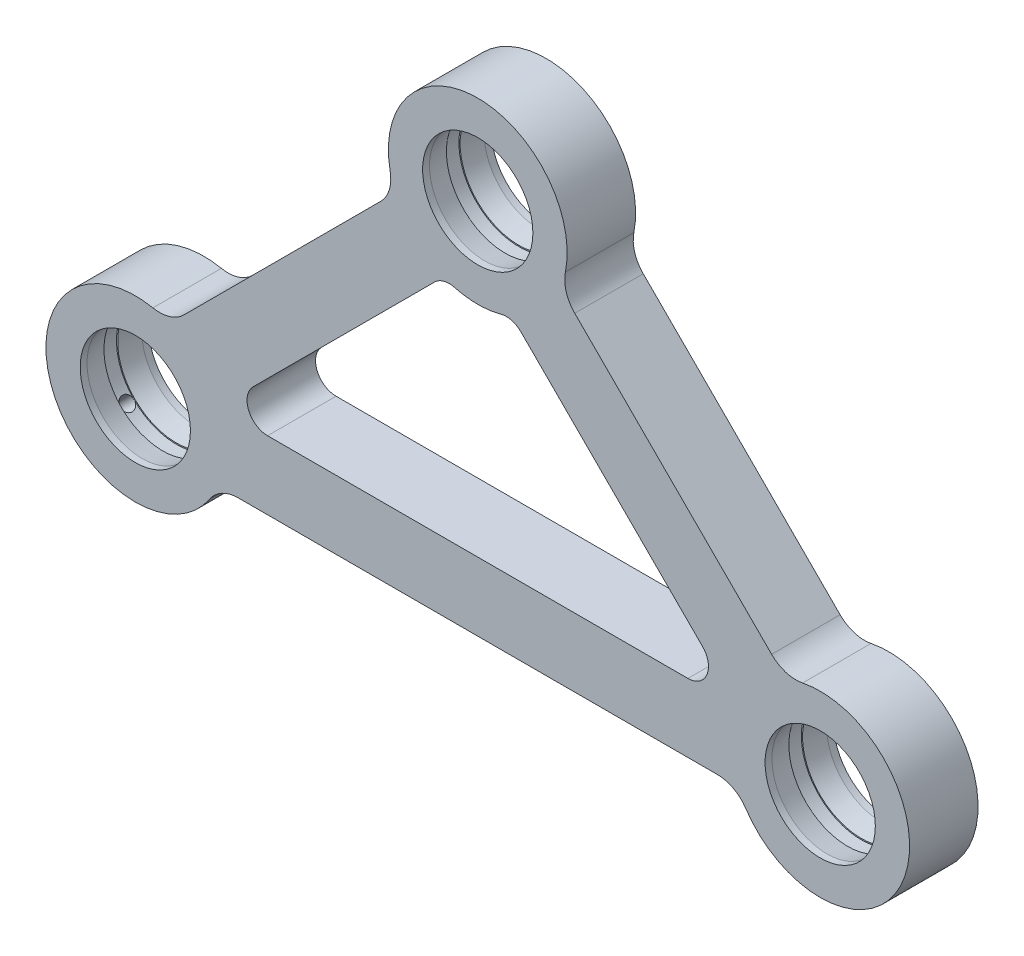
from build123d import *

# Parameters (mm, degrees)
SKETCH1_R               = 8.05
BOSS_EXTRUDE1_DEPTH     = 8
CUT_EXTRUDE1_DEPTH      = 1
CUT_EXTRUDE1_DEPTH_BACK = 1
SKETCH3_R               = 8.755307923
SKETCH4_R               = 1
CUT_EXTRUDE2_DEPTH      = 6
FILLET1_R               = 3
FILLET2_R               = 5
SKETCH5_R               = 1
CUT_EXTRUDE3_DEPTH      = 10
DRAFT4_ANGLE            = -10
DRAFT6_ANGLE            = -10
SKETCH6_R               = 1
CUT_EXTRUDE4_DEPTH      = 10
BOSS_EXTRUDE3_START     = 1
SKETCH7_R               = 8.05
BOSS_EXTRUDE3_DEPTH     = 1
SKETCH11_R              = 8.05
BOSS_EXTRUDE4_DEPTH     = 1


with BuildPart() as part:
    # Sketch1 → Boss-Extrude1 (new body)
    with BuildSketch(Plane.XY):
        with BuildLine():
            Line((11.402892275, 45.011963645), (-21.549967203, 12.059104167))
            ThreePointArc((-21.549967203, 12.059104167), (-38.594631457, -4.994018792), (-14.483854895, -5))
            Line((-14.483854895, -5), (61.407847779, -5))
            ThreePointArc((61.407847779, -5), (85.518624341, -4.994018792), (68.473960087, 12.059104167))
            Line((68.473960087, 12.059104167), (35.521100609, 45.011963645))
            ThreePointArc((35.521100609, 45.011963645), (23.461996442, 63.05), (11.402892275, 45.011963645))
        make_face()
        with BuildLine():
            Line((-14.466935746, 5), (18.473960087, 37.940895833))
            ThreePointArc((18.473960087, 37.940895833), (23.461996442, 36.95), (28.450032797, 37.940895833))
            Line((28.450032797, 37.940895833), (61.39092863, 5))
            Line((61.39092863, 5), (-14.466935746, 5))
        make_face(mode=Mode.SUBTRACT)
        with Locations((-26.538003558, 0)):
            Circle(SKETCH1_R, mode=Mode.SUBTRACT)
        with Locations((23.461996442, 50)):
            Circle(SKETCH1_R, mode=Mode.SUBTRACT)
        with Locations((73.461996442, 0)):
            Circle(SKETCH1_R, mode=Mode.SUBTRACT)
    extrude(amount=BOSS_EXTRUDE1_DEPTH)

    # Sketch3 → Cut-Extrude1 (cut, two sides: drawn at the far end of the back side and taken through both)
    with BuildSketch(Plane.XY.offset(4).offset(-CUT_EXTRUDE1_DEPTH_BACK)):
        with Locations((-26.538003558, 0)):
            Circle(SKETCH3_R)
        with Locations((23.461996442, 50)):
            Circle(SKETCH3_R)
        with Locations((73.461996442, 0)):
            Circle(SKETCH3_R)
    extrude(amount=CUT_EXTRUDE1_DEPTH + CUT_EXTRUDE1_DEPTH_BACK, mode=Mode.SUBTRACT)

    # Sketch4 → Cut-Extrude2 (cut)
    with BuildSketch(Plane(origin=(0, 62.95, 0), x_dir=(-1, 0, 0), z_dir=(0, -1, 0))):
        with Locations((-23.461996442, -4)):
            Circle(SKETCH4_R)
    extrude(amount=CUT_EXTRUDE2_DEPTH, mode=Mode.SUBTRACT)

    # Fillet1
    fillet1_edges = [part.edges().sort_by_distance(p)[0] for p in [
        (-14.466935746, 5, 4),
        (18.473960087, 37.940895833, 4),
        (28.450032797, 37.940895833, 4),
        (61.39092863, 5, 4),
    ]]
    fillet(fillet1_edges, radius=FILLET1_R)

    # Fillet2
    fillet2_edges = [part.edges().sort_by_distance(p)[0] for p in [
        (68.473960087, 12.059104167, 4),
        (35.521100609, 45.011963645, 4),
        (11.402892275, 45.011963645, 4),
        (-21.549967203, 12.059104167, 4),
        (-14.483854895, -5, 4),
        (61.407847779, -5, 4),
    ]]
    fillet(fillet2_edges, radius=FILLET2_R)

    # Sketch5 → Cut-Extrude3 (cut)
    with BuildSketch(Plane(origin=(45.888031037, -45.888031037, 0), x_dir=(0, 0, 1), z_dir=(-0.7071067811865489, 0.7071067811865462, 0))):
        with Locations((4, 51.945475844)):
            Circle(SKETCH5_R)
    extrude(amount=CUT_EXTRUDE3_DEPTH, mode=Mode.SUBTRACT)

    # Draft4
    draft4_faces = [part.faces().sort_by_distance(p)[0] for p in [
        (-34.588003558, 0, 6.5),
        (15.411996442, 50, 6.5),
        (65.411996442, 0, 6.5),
    ]]
    draft(draft4_faces, Plane.XY.offset(8), DRAFT4_ANGLE)

    # Draft6
    draft6_faces = [part.faces().sort_by_distance(p)[0] for p in [
        (-34.588003558, 0, 1.5),
        (65.411996442, 0, 1.5),
        (15.411996442, 50, 1.5),
    ]]
    draft(draft6_faces, Plane(origin=(0, 0, 0), x_dir=(-1, 0, 0), z_dir=(0, 0, -1)), DRAFT6_ANGLE)

    # Sketch6 → Cut-Extrude4 (cut)
    with BuildSketch(Plane(origin=(-22.426034595, -22.426034595, 0), x_dir=(0, 0, -1), z_dir=(0.7071067811865486, 0.7071067811865465, 0))):
        with Locations((-4, 18.765202275)):
            Circle(SKETCH6_R)
    extrude(amount=CUT_EXTRUDE4_DEPTH, mode=Mode.SUBTRACT)

    # Sketch7 → Boss-Extrude3 (add)
    with BuildSketch(Plane.XY.offset(8).offset(BOSS_EXTRUDE3_START)):
        with BuildLine():
            Line((66.37203036, 14.161033894), (37.623030336, 42.910033918))
            ThreePointArc((37.623030336, 42.910033918), (36.372509491, 44.998612426), (36.256467899, 47.430175075))
            ThreePointArc((36.256467899, 47.430175075), (23.461996442, 63.05), (10.667524985, 47.430175075))
            ThreePointArc((10.667524985, 47.430175075), (10.551483393, 44.998612426), (9.300962548, 42.910033918))
            Line((9.300962548, 42.910033918), (-19.448037476, 14.161033894))
            ThreePointArc((-19.448037476, 14.161033894), (-21.536615984, 12.910513049), (-23.968178633, 12.794471457))
            ThreePointArc((-23.968178633, 12.794471457), (-38.594631457, -4.994018792), (-15.673805398, -7.229916898))
            ThreePointArc((-15.673805398, -7.229916898), (-13.872377163, -5.592596257), (-11.511277368, -5))
            Line((-11.511277368, -5), (58.435270252, -5))
            ThreePointArc((58.435270252, -5), (60.796370047, -5.592596257), (62.597798282, -7.229916898))
            ThreePointArc((62.597798282, -7.229916898), (85.518624341, -4.994018792), (70.892171517, 12.794471457))
            ThreePointArc((70.892171517, 12.794471457), (68.460608868, 12.910513049), (66.37203036, 14.161033894))
        make_face()
        with Locations((-26.538003558, 0)):
            Circle(SKETCH7_R, mode=Mode.SUBTRACT)
        with Locations((73.461996442, 0)):
            Circle(SKETCH7_R, mode=Mode.SUBTRACT)
        with Locations((23.461996442, 50)):
            Circle(SKETCH7_R, mode=Mode.SUBTRACT)
        with BuildLine():
            Line((-7.224295059, 5), (54.148287943, 5))
            ThreePointArc((54.148287943, 5), (56.919926541, 6.851949703), (56.269608287, 10.121320344))
            Line((56.269608287, 10.121320344), (29.765225162, 36.625703469))
            ThreePointArc((29.765225162, 36.625703469), (28.41775702, 37.402857339), (26.862239701, 37.400760111))
            ThreePointArc((26.862239701, 37.400760111), (23.461996442, 36.95), (20.061753183, 37.400760111))
            ThreePointArc((20.061753183, 37.400760111), (18.506235864, 37.402857339), (17.158767722, 36.625703469))
            Line((17.158767722, 36.625703469), (-9.345615403, 10.121320344))
            ThreePointArc((-9.345615403, 10.121320344), (-9.995933657, 6.851949703), (-7.224295059, 5))
        make_face(mode=Mode.SUBTRACT)
    extrude(amount=-BOSS_EXTRUDE3_DEPTH)

    # Sketch11 → Boss-Extrude4 (add)
    with BuildSketch(Plane(origin=(0, 0, 0), x_dir=(-1, 0, 0), z_dir=(0, 0, -1))):
        with BuildLine():
            Line((-37.623030336, 42.910033918), (-66.37203036, 14.161033894))
            ThreePointArc((-66.37203036, 14.161033894), (-68.460608868, 12.910513049), (-70.892171517, 12.794471457))
            ThreePointArc((-70.892171517, 12.794471457), (-85.518624341, -4.994018792), (-62.597798282, -7.229916898))
            ThreePointArc((-62.597798282, -7.229916898), (-60.796370047, -5.592596257), (-58.435270252, -5))
            Line((-58.435270252, -5), (11.511277368, -5))
            ThreePointArc((11.511277368, -5), (13.872377163, -5.592596257), (15.673805398, -7.229916898))
            ThreePointArc((15.673805398, -7.229916898), (38.594631457, -4.994018792), (23.968178633, 12.794471457))
            ThreePointArc((23.968178633, 12.794471457), (21.536615984, 12.910513049), (19.448037476, 14.161033894))
            Line((19.448037476, 14.161033894), (-9.300962548, 42.910033918))
            ThreePointArc((-9.300962548, 42.910033918), (-10.551483393, 44.998612426), (-10.667524985, 47.430175075))
            ThreePointArc((-10.667524985, 47.430175075), (-23.461996442, 63.05), (-36.256467899, 47.430175075))
            ThreePointArc((-36.256467899, 47.430175075), (-36.372509491, 44.998612426), (-37.623030336, 42.910033918))
        make_face()
        with Locations((-73.461996442, 0)):
            Circle(SKETCH11_R, mode=Mode.SUBTRACT)
        with Locations((-23.461996442, 50)):
            Circle(SKETCH11_R, mode=Mode.SUBTRACT)
        with Locations((26.538003558, 0)):
            Circle(SKETCH11_R, mode=Mode.SUBTRACT)
        with BuildLine():
            Line((-17.158767722, 36.625703469), (9.345615403, 10.121320344))
            ThreePointArc((9.345615403, 10.121320344), (9.995933657, 6.851949703), (7.224295059, 5))
            Line((7.224295059, 5), (-54.148287943, 5))
            ThreePointArc((-54.148287943, 5), (-56.919926541, 6.851949703), (-56.269608287, 10.121320344))
            Line((-56.269608287, 10.121320344), (-29.765225162, 36.625703469))
            ThreePointArc((-29.765225162, 36.625703469), (-28.41775702, 37.402857339), (-26.862239701, 37.400760111))
            ThreePointArc((-26.862239701, 37.400760111), (-23.461996442, 36.95), (-20.061753183, 37.400760111))
            ThreePointArc((-20.061753183, 37.400760111), (-18.506235864, 37.402857339), (-17.158767722, 36.625703469))
        make_face(mode=Mode.SUBTRACT)
    extrude(amount=BOSS_EXTRUDE4_DEPTH)


solid = part.part
